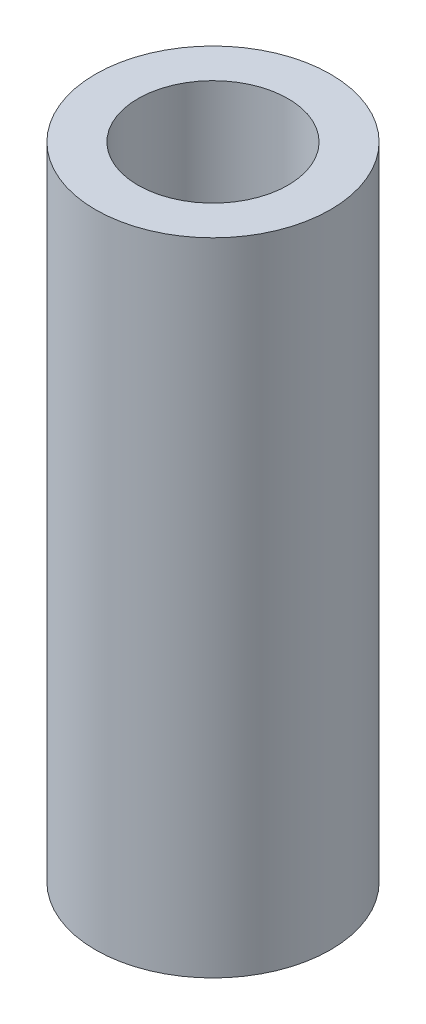
from build123d import *

# Parameters (mm, degrees)
SKETCH1_R           = 25
BOSS_EXTRUDE1_DEPTH = 136.431675433
SKETCH2_R           = 15.971009097
CUT_EXTRUDE1_DEPTH  = 141.938291679


with BuildPart() as part:
    # Sketch1 → Boss-Extrude1 (new body)
    with BuildSketch(Plane(origin=(0, 0, 0), x_dir=(1, 0, 0), z_dir=(0, 1, 0))):
        Circle(SKETCH1_R)
    extrude(amount=BOSS_EXTRUDE1_DEPTH)

    # Sketch2 → Cut-Extrude1 (cut, through all)
    with BuildSketch(Plane(origin=(0, 0, 0), x_dir=(1, 0, 0), z_dir=(0, 1, 0))):
        Circle(SKETCH2_R)
    extrude(amount=CUT_EXTRUDE1_DEPTH, mode=Mode.SUBTRACT)


solid = part.part
